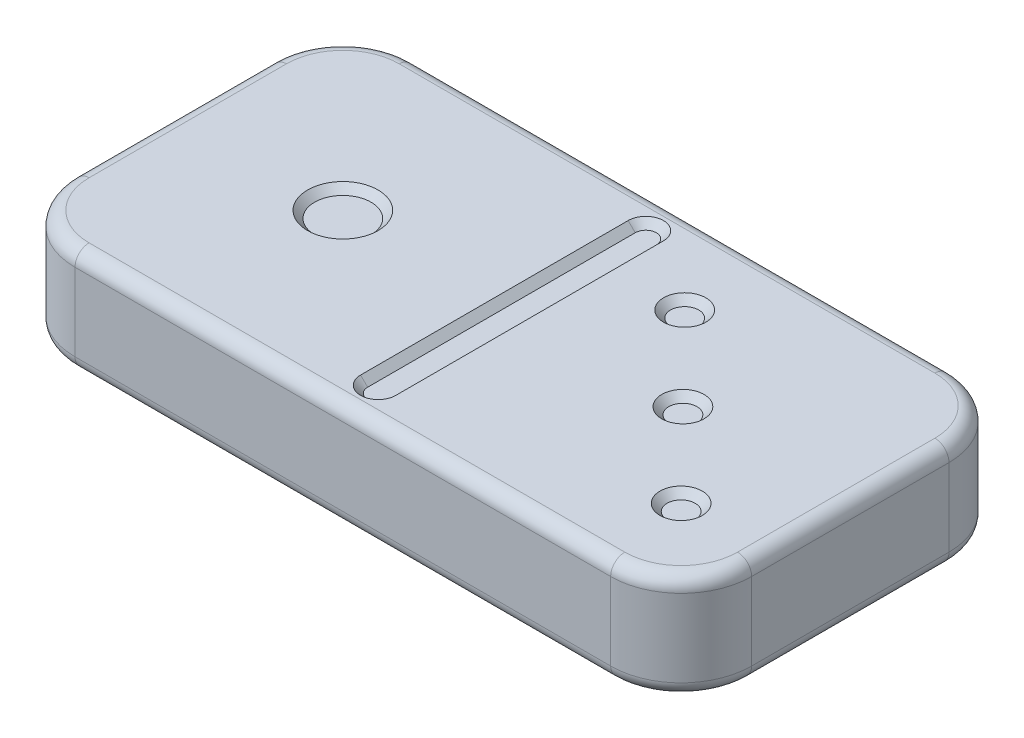
from build123d import *

# Parameters (mm, degrees)
ESQUISSE1_W                = 48
ESQUISSE1_H                = 24
EXTRUSION1_DEPTH           = 7.5
CONG_2_R                   = 5
CONG_5_R                   = 1
CONG_6_R                   = 1
ESQUISSE4_W                = 0.5
ESQUISSE4_H                = 18.982849842
EXTRUSION2_DEPTH           = 0.5
ESQUISSE5_R                = 0.25
EXTRUSION3_DEPTH           = 0.5
CHANFREIN1_SIZE            = 1
ESQUISSE9_R                = 1.5
EXTRUSION6_DEPTH           = 0.5
EXTRUSION6_DRAFT           = -45
EXTRUSION6_PROFILE_2_DEPTH = 0.5
EXTRUSION6_PROFILE_2_DRAFT = -45
EXTRUSION6_PROFILE_3_DEPTH = 0.5
EXTRUSION6_PROFILE_3_DRAFT = -45
ESQUISSE10_R               = 2.5
EXTRUSION8_DEPTH           = 0.5
EXTRUSION8_DRAFT           = -45


with BuildPart() as part:
    # Esquisse1 → Extrusion1 (new body)
    with BuildSketch(Plane(origin=(0, 0, 0), x_dir=(1, 0, 0), z_dir=(0, 1, 0))):
        with Locations((24, 12)):
            Rectangle(ESQUISSE1_W, ESQUISSE1_H)
    extrude(amount=EXTRUSION1_DEPTH)

    # Congé2
    cong_2_edges = [part.edges().sort_by_distance(p)[0] for p in [
        (0, 3.75, -24),
        (48, 3.75, -24),
        (48, 3.75, 0),
        (0, 3.75, 0),
    ]]
    fillet(cong_2_edges, radius=CONG_2_R)

    # Congé5
    cong_5_edges = [part.edges().sort_by_distance(p)[0] for p in [
        (48, 7.5, -12),
        (24, 7.5, 0),
        (0, 7.5, -12),
        (24, 7.5, -24),
        (1.464466094, 7.5, -22.535533906),
        (1.464466094, 7.5, -1.464466094),
        (46.535533906, 7.5, -22.535533906),
        (46.535533906, 7.5, -1.464466094),
    ]]
    fillet(cong_5_edges, radius=CONG_5_R)

    # Congé6
    cong_6_edges = [part.edges().sort_by_distance(p)[0] for p in [
        (48, 0, -12),
        (0, 0, -12),
        (24, 0, -24),
        (24, 0, 0),
        (1.464466094, 0, -22.535533906),
        (1.464466094, 0, -1.464466094),
        (46.535533906, 0, -22.535533906),
        (46.535533906, 0, -1.464466094),
    ]]
    fillet(cong_6_edges, radius=CONG_6_R)

    # Esquisse4 → Extrusion2 (cut)
    with BuildSketch(Plane(origin=(0, 7.5, 0), x_dir=(1, 0, 0), z_dir=(0, 1, 0))):
        with Locations((24, 12)):
            Rectangle(ESQUISSE4_W, ESQUISSE4_H)
    extrude(amount=-EXTRUSION2_DEPTH, mode=Mode.SUBTRACT)

    # Esquisse5 → Extrusion3 (cut)
    with BuildSketch(Plane(origin=(0, 7.5, 0), x_dir=(1, 0, 0), z_dir=(0, 1, 0))):
        with Locations((24, 21.491424921)):
            Circle(ESQUISSE5_R)
        with Locations((24, 2.508575079)):
            Circle(ESQUISSE5_R)
    extrude(amount=-EXTRUSION3_DEPTH, mode=Mode.SUBTRACT)

    # Chanfrein1
    # the kernel refuses this chamfer: 1 mm, written as the material it takes off along each edge
    with BuildSketch(Plane(origin=(24, 7.5, -21.491424921), x_dir=(1, 0, 0), z_dir=(0, 0, 1))) as chanfrein1_piece_1_section:
        Polygon((0.25 + CHANFREIN1_SIZE, 0), (0.25, -CHANFREIN1_SIZE), (0.25, 0), align=None)
    chanfrein1_piece_1 = revolve(axis=Axis((24, 7.5, -21.491424921), (0, 1, 0)), revolution_arc=180, mode=Mode.PRIVATE)
    chanfrein1_piece_1 = split(chanfrein1_piece_1, bisect_by=Plane(origin=(24, 7, -21.964580549), z_dir=(0, 1, 0)), keep=Keep.TOP, mode=Mode.PRIVATE)
    add(chanfrein1_piece_1, mode=Mode.SUBTRACT)
    with BuildSketch(Plane(origin=(24.25, 7.5, -21.491424921), x_dir=(0.9996219169112968, 0.02749587661058651, 0), z_dir=(0, 0, 1))) as chanfrein1_piece_2_section:
        Polygon((CHANFREIN1_SIZE * 0.999621916911, -CHANFREIN1_SIZE * 0.0274958766106), (-CHANFREIN1_SIZE * 0.0274958766106, -CHANFREIN1_SIZE * 0.999621916911), (0, 0), align=None)
    chanfrein1_piece_2 = extrude(amount=18.982849842, mode=Mode.PRIVATE)
    chanfrein1_piece_2 = split(chanfrein1_piece_2, bisect_by=Plane(origin=(24.643401084, 7, -12), z_dir=(0, 1, 0)), keep=Keep.TOP, mode=Mode.PRIVATE)
    add(chanfrein1_piece_2, mode=Mode.SUBTRACT)
    with BuildSketch(Plane(origin=(24, 7.5, -2.508575079), x_dir=(-1, 0, 0), z_dir=(0, 0, -1))) as chanfrein1_piece_3_section:
        Polygon((0.25 + CHANFREIN1_SIZE, 0), (0.25, -CHANFREIN1_SIZE), (0.25, 0), align=None)
    chanfrein1_piece_3 = revolve(axis=Axis((24, 7.5, -2.508575079), (0, 1, 0)), revolution_arc=180, mode=Mode.PRIVATE)
    chanfrein1_piece_3 = split(chanfrein1_piece_3, bisect_by=Plane(origin=(24, 7, -2.035419451), z_dir=(0, 1, 0)), keep=Keep.TOP, mode=Mode.PRIVATE)
    add(chanfrein1_piece_3, mode=Mode.SUBTRACT)
    with BuildSketch(Plane(origin=(23.75, 7.5, -2.508575079), x_dir=(-0.9996219169112968, 0.02749587661058651, 0), z_dir=(0, 0, -1))) as chanfrein1_piece_4_section:
        Polygon((CHANFREIN1_SIZE * 0.999621916911, -CHANFREIN1_SIZE * 0.0274958766106), (-CHANFREIN1_SIZE * 0.0274958766106, -CHANFREIN1_SIZE * 0.999621916911), (0, 0), align=None)
    chanfrein1_piece_4 = extrude(amount=18.982849842, mode=Mode.PRIVATE)
    chanfrein1_piece_4 = split(chanfrein1_piece_4, bisect_by=Plane(origin=(23.356598916, 7, -12), z_dir=(0, 1, 0)), keep=Keep.TOP, mode=Mode.PRIVATE)
    add(chanfrein1_piece_4, mode=Mode.SUBTRACT)


with BuildPart() as extrusion6_tool:
    # Esquisse9 → Extrusion6 (with draft: the straight prism first)
    with BuildSketch(Plane(origin=(0, 7.5, 0), x_dir=(1, 0, 0), z_dir=(0, 1, 0))):
        with Locations((30.25, 18)):
            Circle(ESQUISSE9_R)
    extrude(amount=-EXTRUSION6_DEPTH)
    # Extrusion6: the draft: its side faces are tilted about the plane it starts from
    extrusion6_sides = [extrusion6_tool.faces().sort_by_distance(p)[0] for p in [
        (28.75, 7.25, -18),
    ]]
    draft(extrusion6_sides, Plane(origin=(0, 7.5, 0), x_dir=(1, 0, 0), z_dir=(0, 1, 0)), EXTRUSION6_DRAFT)


with BuildPart() as part_1:
    add(part.part)

    # Extrusion6: cut by extrusion6_tool
    add(extrusion6_tool.part, mode=Mode.SUBTRACT)


with BuildPart() as extrusion6_profile_2_tool:
    # Esquisse9 → Extrusion6 profile 2 (with draft: the straight prism first)
    with BuildSketch(Plane(origin=(0, 7.5, 0), x_dir=(1, 0, 0), z_dir=(0, 1, 0))):
        with Locations((36.125, 12)):
            Circle(ESQUISSE9_R)
    extrude(amount=-EXTRUSION6_PROFILE_2_DEPTH)
    # Extrusion6 profile 2: the draft: its side faces are tilted about the plane it starts from
    extrusion6_profile_2_sides = [extrusion6_profile_2_tool.faces().sort_by_distance(p)[0] for p in [
        (34.625, 7.25, -12),
    ]]
    draft(extrusion6_profile_2_sides, Plane(origin=(0, 7.5, 0), x_dir=(1, 0, 0), z_dir=(0, 1, 0)), EXTRUSION6_PROFILE_2_DRAFT)


with BuildPart() as part_2:
    add(part_1.part)

    # Extrusion6 profile 2: cut by extrusion6_profile_2_tool
    add(extrusion6_profile_2_tool.part, mode=Mode.SUBTRACT)


with BuildPart() as extrusion6_profile_3_tool:
    # Esquisse9 → Extrusion6 profile 3 (with draft: the straight prism first)
    with BuildSketch(Plane(origin=(0, 7.5, 0), x_dir=(1, 0, 0), z_dir=(0, 1, 0))):
        with Locations((42, 6)):
            Circle(ESQUISSE9_R)
    extrude(amount=-EXTRUSION6_PROFILE_3_DEPTH)
    # Extrusion6 profile 3: the draft: its side faces are tilted about the plane it starts from
    extrusion6_profile_3_sides = [extrusion6_profile_3_tool.faces().sort_by_distance(p)[0] for p in [
        (40.5, 7.25, -6),
    ]]
    draft(extrusion6_profile_3_sides, Plane(origin=(0, 7.5, 0), x_dir=(1, 0, 0), z_dir=(0, 1, 0)), EXTRUSION6_PROFILE_3_DRAFT)


with BuildPart() as part_3:
    add(part_2.part)

    # Extrusion6 profile 3: cut by extrusion6_profile_3_tool
    add(extrusion6_profile_3_tool.part, mode=Mode.SUBTRACT)


with BuildPart() as extrusion8_tool:
    # Esquisse10 → Extrusion8 (with draft: the straight prism first)
    with BuildSketch(Plane(origin=(0, 7.5, 0), x_dir=(1, 0, 0), z_dir=(0, 1, 0))):
        with Locations((12, 12)):
            Circle(ESQUISSE10_R)
    extrude(amount=-EXTRUSION8_DEPTH)
    # Extrusion8: the draft: its side faces are tilted about the plane it starts from
    extrusion8_sides = [extrusion8_tool.faces().sort_by_distance(p)[0] for p in [
        (9.5, 7.25, -12),
    ]]
    draft(extrusion8_sides, Plane(origin=(0, 7.5, 0), x_dir=(1, 0, 0), z_dir=(0, 1, 0)), EXTRUSION8_DRAFT)


with BuildPart() as part_4:
    add(part_3.part)

    # Extrusion8: cut by extrusion8_tool
    add(extrusion8_tool.part, mode=Mode.SUBTRACT)


solid = part_4.part
